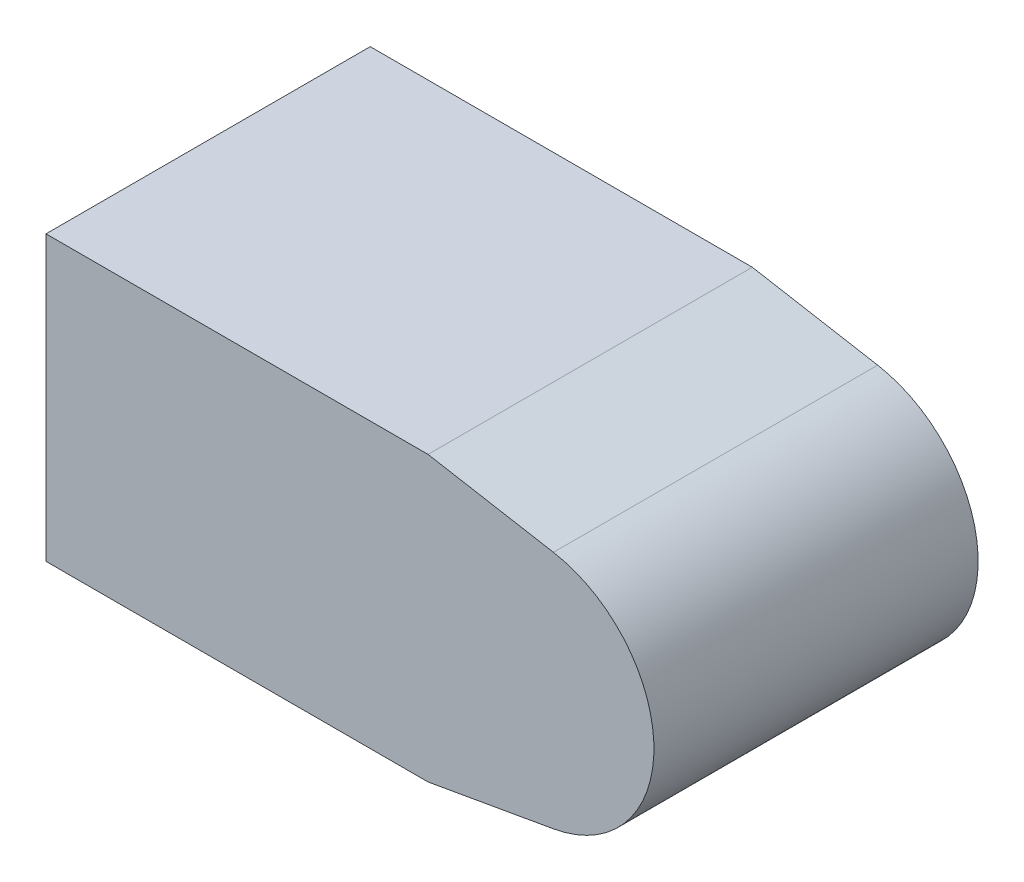
from build123d import *

# Parameters (mm, degrees)
BOSS_EXTRUDE1_DEPTH = 40


with BuildPart() as part:
    # Sketch1 → Boss-Extrude1 (new, symmetric)
    with BuildSketch(Plane.XY):
        with BuildLine():
            Line((-54.159677949, -43.884825983), (40.108572858, -43.884825983))
            Line((40.108572858, -43.884825983), (71.049767381, -38.429058573))
            ThreePointArc((71.049767381, -38.429058573), (95.840322051, -8.884825983), (71.049767381, 20.659406608))
            Line((71.049767381, 20.659406608), (40.108572858, 26.115174017))
            Line((40.108572858, 26.115174017), (-54.159677949, 26.115174017))
            Line((-54.159677949, 26.115174017), (-54.159677949, -43.884825983))
        make_face()
    extrude(amount=BOSS_EXTRUDE1_DEPTH, both=True)


solid = part.part
